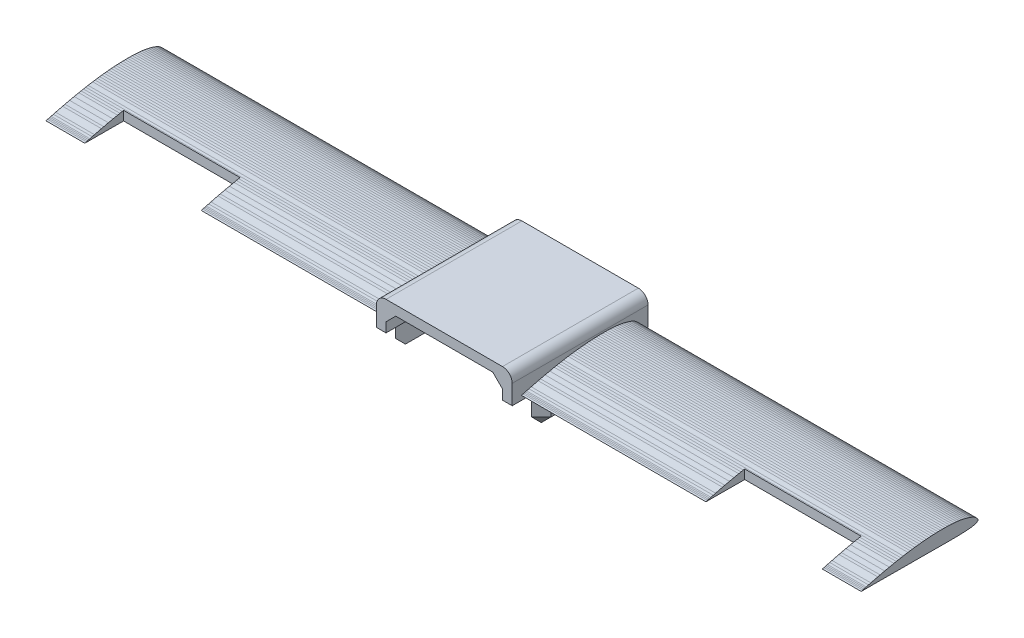
from build123d import *

# Parameters (mm, degrees)
BOSS_EXTRUDE1_DEPTH             = 70
BOSS_EXTRUDE2_DEPTH             = 175
CUT_EXTRUDE3_REACH              = 223.867
SKETCH9_W                       = 60
SKETCH9_H                       = 20
BOSS_EXTRUDE3_REACH             = 223.867
BOSS_EXTRUDE3_DIRECTION_2_DEPTH = 10
LOFT1_START                     = 10
LOFT1_DEPTH                     = 50
LOFT1_START_2                   = -22
LOFT1_2_DEPTH                   = 9
SKETCH8_R                       = 2.25
CUT_EXTRUDE1_DEPTH              = 2
CUT_EXTRUDE2_REACH              = 262.048
SKETCH8_3_R                     = 1


with BuildPart() as part:
    # Sketch1 → Boss-Extrude1 (new body)
    with BuildSketch(Plane.XY):
        with BuildLine():
            Line((-30, 0), (-35, 0))
            Line((-35, 0), (-35, 10))
            ThreePointArc((-35, 10), (-33.535533906, 13.535533906), (-30, 15))
            Line((-30, 15), (30, 15))
            ThreePointArc((30, 15), (33.535533906, 13.535533906), (35, 10))
            Line((35, 10), (35, 0))
            Line((35, 0), (30, 0))
            Line((30, 0), (30, 5))
            Line((30, 5), (25, 10))
            Line((25, 10), (-25, 10))
            Line((-25, 10), (-30, 5))
            Line((-30, 5), (-30, 0))
        make_face()
    extrude(amount=BOSS_EXTRUDE1_DEPTH)

    # Sketch3 → Boss-Extrude2 (add)
    with BuildSketch(Plane.ZY.offset(35)):
        Polygon((65.19977735, 2.25), (64.373245759, 2.486572833), (63.782964065, 2.645530446), (63.182682388, 2.804470395), (62.592400694, 2.963428007), (61.401837323, 3.281325569), (60.211291616, 3.589223146), (59.020763571, 3.887120739), (57.830235527, 4.185018331), (56.639707483, 4.482915924), (55.439214781, 4.760795885), (54.248722063, 5.038693508), (53.058229346, 5.316591132), (51.867771955, 5.574488788), (50.677314564, 5.832386443), (49.486874836, 6.080284113), (48.296435109, 6.328181784), (47.09601306, 6.566061807), (45.905608659, 6.793959509), (44.715221922, 7.011857226), (43.5148352, 7.229737281), (42.324483789, 7.427635029), (41.134132379, 7.625532778), (39.933816328, 7.803402895), (38.743500244, 7.981300675), (37.543219502, 8.139180822), (36.352956408, 8.287078649), (35.152710993, 8.424958828), (33.962483226, 8.552856686), (32.762273138, 8.670736896), (31.562080713, 8.778617122), (30.361923614, 8.866497379), (29.171784164, 8.944395315), (27.971680056, 9.002275618), (26.771593611, 9.050155938), (25.57152483, 9.088036273), (24.371491375, 9.105916639), (23.171475583, 9.113797021), (21.971477455, 9.111677418), (20.771496991, 9.099557831), (19.571569516, 9.057438291), (18.361677384, 8.995301118), (17.161838226, 8.903181656), (15.952069737, 8.771044593), (14.752354223, 8.60892524), (13.542727041, 8.396788301), (12.333170512, 8.144651425), (11.123684637, 7.852514612), (9.914304724, 7.500387892), (8.695048489, 7.078233617), (8.085491024, 6.827156543), (7.476004213, 6.53607953), (6.866605719, 6.195002596), (6.247383873, 5.753908155), (5.758144162, 5.323043321), (5.508568473, 5.082602111), (5.259063437, 4.802160964), (5.129399243, 4.611931637), (5.069611297, 4.491825844), (5.029752666, 4.411755316), (5, 4.271702544), (5.020494543, 3.991738307), (5.050635803, 3.911791422), (5.100830022, 3.801879911), (5.221130112, 3.632092136), (5.45153601, 3.402498752), (5.681835928, 3.232905274), (6.162223773, 3.013753459), (6.752505467, 2.854795846), (7.352734154, 2.72585585), (7.942945194, 2.606898176), (8.543085565, 2.527958102), (9.743295653, 2.410077891), (10.93347043, 2.312179987), (12.133609865, 2.234299714), (13.333713973, 2.17641941), (14.533782755, 2.138539076), (15.733833873, 2.110658725), (16.933867328, 2.092778359), (18.133883119, 2.084897977), (19.333881247, 2.08701758), (20.533879375, 2.089137182), (21.733877503, 2.091256785), (22.933875631, 2.093376388), (24.133856096, 2.105495975), (25.343854208, 2.107633241), (26.543852336, 2.109752843), (27.743850464, 2.111872446), (28.943830929, 2.123992033), (30.143829057, 2.126111636), (31.343827185, 2.128231238), (32.543825313, 2.130350841), (33.743823441, 2.132470444), (34.943803906, 2.144590031), (36.143802034, 2.146709633), (37.343800162, 2.148829236), (38.54379829, 2.150948839), (39.753796402, 2.153086105), (40.953776867, 2.165205692), (42.153774995, 2.167325294), (43.353773123, 2.169444897), (44.553771251, 2.1715645), (45.753751716, 2.183684087), (46.953749844, 2.185803689), (48.153747972, 2.187923292), (49.3537461, 2.190042895), (50.553744228, 2.192162497), (51.753724693, 2.204282084), (52.953722821, 2.206401687), (54.153720949, 2.20852129), (55.363719061, 2.210658556), (56.563717189, 2.212778158), (57.763697654, 2.224897745), (58.963695782, 2.227017348), (60.16369391, 2.229136951), (61.363692038, 2.231256553), (62.563672503, 2.24337614), (63.163671567, 2.244435942), (63.763670631, 2.245495743), (64.363669695, 2.246555544), (64.963668759, 2.247615346), align=None)
    boss_extrude2 = extrude(amount=BOSS_EXTRUDE2_DEPTH)

    # Sketch9 → Cut-Extrude3 (cut, up to next)
    with BuildSketch(Plane(origin=(0, 0, 0), x_dir=(1, 0, 0), z_dir=(0, 1, 0)), mode=Mode.PRIVATE) as cut_extrude3_sk1:
        with Locations((-160, -55.19977735)):
            Rectangle(SKETCH9_W, SKETCH9_H)
    cut_extrude3_tool1 = extrude(cut_extrude3_sk1.sketch, amount=CUT_EXTRUDE3_REACH, mode=Mode.PRIVATE) & part.part
    cut_extrude3 = cut_extrude3_tool1.solids().sort_by_distance((-160, 0, 55.199777))[0]
    add(cut_extrude3, mode=Mode.SUBTRACT)

    # Mirror1: Boss-Extrude2, Cut-Extrude3 across plane
    add(boss_extrude2.mirror(Plane(origin=(0, 0, 0), x_dir=(0, 0, 1), z_dir=(1, 0, 0))))
    add(cut_extrude3.mirror(Plane(origin=(0, 0, 0), x_dir=(0, 0, 1), z_dir=(1, 0, 0))), mode=Mode.SUBTRACT)

    # Sketch4 → Boss-Extrude3 (add, up to next)
    with BuildSketch(Plane(origin=(0, 0, 0), x_dir=(-1, 0, 0), z_dir=(0, -1, 0)), mode=Mode.PRIVATE) as boss_extrude3_sk1:
        Polygon((35, -10), (40, -15), (40, -55), (35, -60), align=None)
    boss_extrude3_tool1 = extrude(boss_extrude3_sk1.sketch, amount=-BOSS_EXTRUDE3_REACH, mode=Mode.PRIVATE) - part.part
    boss_extrude3 = boss_extrude3_tool1.solids().sort_by_distance((-37.407407, 0, 35))[0]
    add(boss_extrude3)

    # Sketch4 → Boss-Extrude3 direction 2 (add)
    with BuildSketch(Plane(origin=(0, 0, 0), x_dir=(-1, 0, 0), z_dir=(0, -1, 0))):
        Polygon((35, -10), (40, -15), (40, -55), (35, -60), align=None)
    boss_extrude3_direction_2 = extrude(amount=BOSS_EXTRUDE3_DIRECTION_2_DEPTH)

    # Loft1: read off the stored shape, not the designer's step
    # Loft1 outline → Loft1 (add)
    with BuildSketch(Plane.XY.offset(LOFT1_START)):
        Polygon((-35, -15), (-35, -10), (-40, -10), align=None)
    loft1 = extrude(amount=LOFT1_DEPTH)

    # Loft1 2 outline → Loft1 2 (cut)
    with BuildSketch(Plane(origin=(0, 0, 0), x_dir=(0.7071067811865477, 0.7071067811865474, 0), z_dir=(0.7071067811865475, -0.7071067811865475, 0)).offset(LOFT1_START_2)):
        Polygon((-31.819805153, 10), (-35.355339059, 15), (-35.355339059, 10), align=None)
        Polygon((-35.355339059, 60), (-35.355339059, 55), (-31.819805153, 60), align=None)
    loft1_2 = extrude(amount=LOFT1_2_DEPTH, mode=Mode.SUBTRACT)

    # Sketch8 → Cut-Extrude1 (cut)
    with BuildSketch(Plane.ZY.offset(40)):
        with Locations((20, -7)):
            Circle(SKETCH8_R)
        with Locations((50, -7)):
            Circle(SKETCH8_R)
    cut_extrude1 = extrude(amount=-CUT_EXTRUDE1_DEPTH, mode=Mode.SUBTRACT)

    # Sketch8<3> → Cut-Extrude2 (cut, up to next)
    with BuildSketch(Plane.ZY.offset(40), mode=Mode.PRIVATE) as cut_extrude2_sk1:
        with Locations((20, -7)):
            Circle(SKETCH8_3_R)
    cut_extrude2_tool1 = extrude(cut_extrude2_sk1.sketch, amount=-CUT_EXTRUDE2_REACH, mode=Mode.PRIVATE) & part.part
    # Sketch8<3> → Cut-Extrude2 (cut, up to next)
    with BuildSketch(Plane.ZY.offset(40), mode=Mode.PRIVATE) as cut_extrude2_sk2:
        with Locations((50, -7)):
            Circle(SKETCH8_3_R)
    cut_extrude2_tool2 = extrude(cut_extrude2_sk2.sketch, amount=-CUT_EXTRUDE2_REACH, mode=Mode.PRIVATE) & part.part
    cut_extrude2_1 = cut_extrude2_tool1.solids().sort_by_distance((-40, -7, 20))[0]
    add(cut_extrude2_1, mode=Mode.SUBTRACT)
    cut_extrude2_2 = cut_extrude2_tool2.solids().sort_by_distance((-40, -7, 50))[0]
    add(cut_extrude2_2, mode=Mode.SUBTRACT)
    cut_extrude2 = cut_extrude2_1 + cut_extrude2_2  # Cut-Extrude2 as one shape, for the pattern or mirror that repeats it

    # Mirror2: Boss-Extrude3, Boss-Extrude3 direction 2, Loft1, Loft1 2, Cut-Extrude1, Cut-Extrude2 across plane
    add(boss_extrude3.mirror(Plane(origin=(0, 0, 0), x_dir=(0, 0, 1), z_dir=(1, 0, 0))))
    add(boss_extrude3_direction_2.mirror(Plane(origin=(0, 0, 0), x_dir=(0, 0, 1), z_dir=(1, 0, 0))))
    add(loft1.mirror(Plane(origin=(0, 0, 0), x_dir=(0, 0, 1), z_dir=(1, 0, 0))))
    add(loft1_2.mirror(Plane(origin=(0, 0, 0), x_dir=(0, 0, 1), z_dir=(1, 0, 0))), mode=Mode.SUBTRACT)
    add(cut_extrude1.mirror(Plane(origin=(0, 0, 0), x_dir=(0, 0, 1), z_dir=(1, 0, 0))), mode=Mode.SUBTRACT)
    add(cut_extrude2.mirror(Plane(origin=(0, 0, 0), x_dir=(0, 0, 1), z_dir=(1, 0, 0))), mode=Mode.SUBTRACT)


solid = part.part
